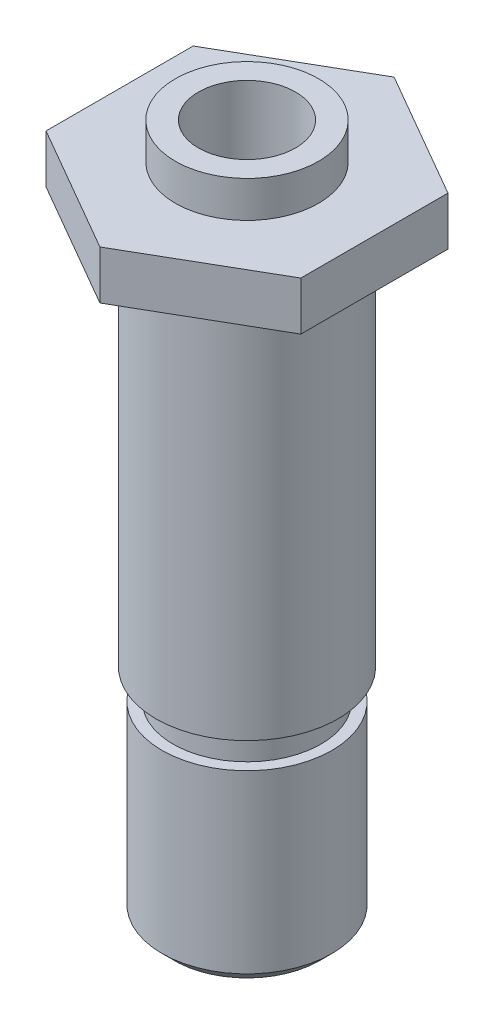
from build123d import *

# Parameters (mm, degrees)
EXTRUDE_1_DEPTH     = 4
SKETCH_2_R          = 5.9
EXTRUDE_2_DEPTH     = 3
SKETCH_3_R          = 7.5
EXTRUDE_3_DEPTH     = 50
SKETCH_4_R          = 4
CUT_EXTRUDE_1_DEPTH = 35
SKETCH_7_R          = 2
CUT_EXTRUDE_2_DEPTH = 60.213596412
CHAMFER_1_SIZE      = 1


with BuildPart() as part:
    # Эскиз1 → Бобышка-Вытянуть1 (new body)
    with BuildSketch(Plane(origin=(0, 0, 0), x_dir=(1, 0, 0), z_dir=(0, 1, 0))):
        Polygon((10.5, -6.062177826), (10.5, 6.062177826), (0, 12.124355653), (-10.5, 6.062177826), (-10.5, -6.062177826), (0, -12.124355653), align=None)
    extrude(amount=EXTRUDE_1_DEPTH)

    # Эскиз2 → Бобышка-Вытянуть2 (add)
    with BuildSketch(Plane(origin=(0, 4, 0), x_dir=(1, 0, 0), z_dir=(0, 1, 0))):
        Circle(SKETCH_2_R)
    extrude(amount=EXTRUDE_2_DEPTH)

    # Эскиз3 → Бобышка-Вытянуть3 (add)
    with BuildSketch(Plane.XZ):
        Circle(SKETCH_3_R)
    extrude(amount=EXTRUDE_3_DEPTH)

    # Эскиз4 → Вырез-Вытянуть1 (cut)
    with BuildSketch(Plane(origin=(0, 7, 0), x_dir=(1, 0, 0), z_dir=(0, 1, 0))):
        Circle(SKETCH_4_R)
    extrude(amount=-CUT_EXTRUDE_1_DEPTH, mode=Mode.SUBTRACT)

    # Эскиз6 → Вырез-Повернуть1 (revolve, cut)
    with BuildSketch(Plane(origin=(0, 0, 0), x_dir=(0, 0, -1), z_dir=(1, 0, 0))):
        Polygon((7.5, -50), (7.5, -32), (6.1, -32), (6.1, -34.5), (7, -34.5), (7, -50), align=None)
    revolve(axis=Axis((0, -50.526489701, 0), (0, 1, 0)), mode=Mode.SUBTRACT)

    # Эскиз7 → Вырез-Вытянуть2 (cut, through all)
    with BuildSketch(Plane.XZ.offset(50)):
        Circle(SKETCH_7_R)
    extrude(amount=-CUT_EXTRUDE_2_DEPTH, mode=Mode.SUBTRACT)

    # Фаска1
    chamfer_1_edges = [part.edges().sort_by_distance(p)[0] for p in [
        (0, -50, 7),
    ]]
    chamfer(chamfer_1_edges, length=CHAMFER_1_SIZE)


solid = part.part
